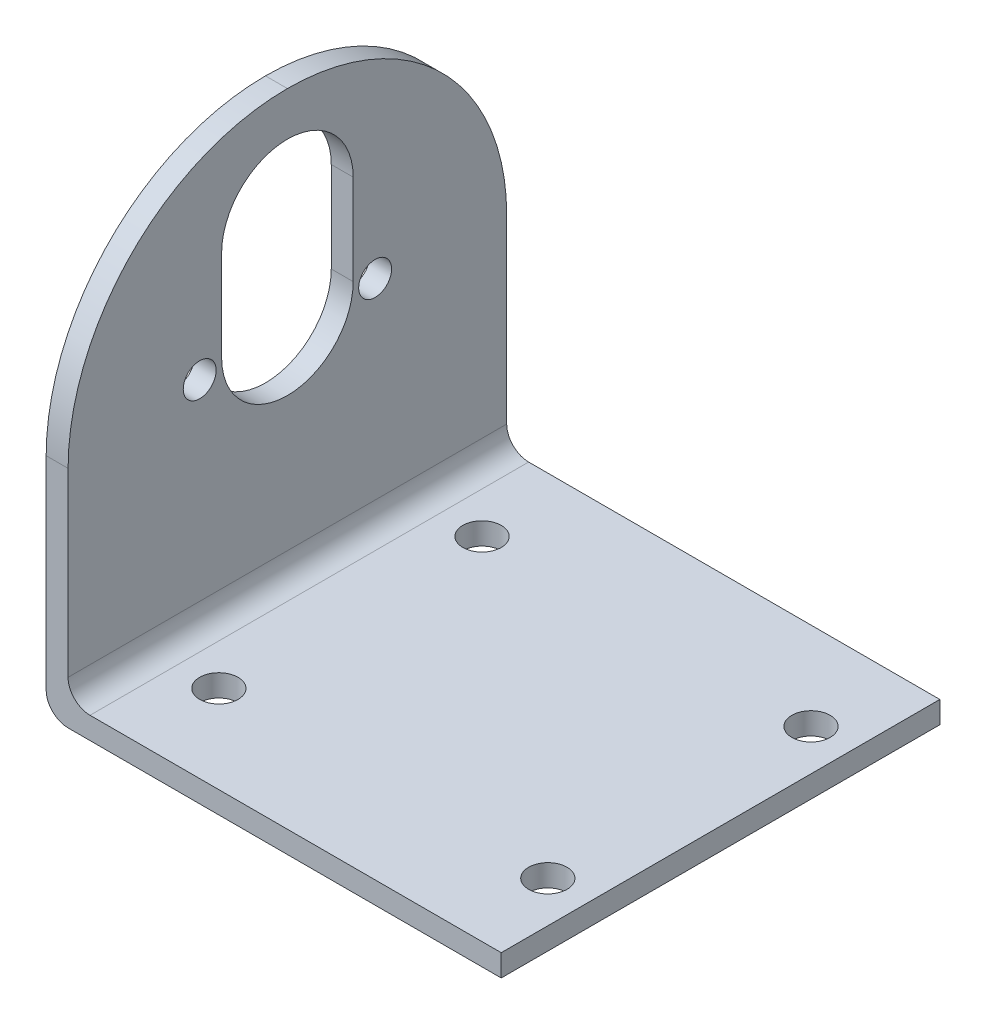
from build123d import *

# Parameters (mm, degrees)
EXTRUDE_1_DEPTH     = 40
SKETCH_2_R          = 1.75
CUT_EXTRUDE_1_DEPTH = 69.135893624
CUT_EXTRUDE_2_DEPTH = 69.135893624
FILLET_1_R          = 20
FILLET_2_R          = 20
SKETCH_7_R          = 1.5
CUT_EXTRUDE_3_DEPTH = 69.135893624


with BuildPart() as part:
    # 草图1 → 凸台-拉伸1 (new body)
    with BuildSketch(Plane.XY):
        with BuildLine():
            Line((0, 38.5), (0, 2))
            ThreePointArc((0, 2), (0.585786438, 0.585786438), (2, 0))
            Line((2, 0), (39.5, 0))
            Line((39.5, 0), (39.5, -2))
            Line((39.5, -2), (0, -2))
            ThreePointArc((0, -2), (-1.414213562, -1.414213562), (-2, 0))
            Line((-2, 0), (-2, 38.5))
            Line((-2, 38.5), (0, 38.5))
        make_face()
    extrude(amount=EXTRUDE_1_DEPTH)

    # 草图2 → 切除-拉伸1 (cut, through all)
    with BuildSketch(Plane(origin=(0, 0, 0), x_dir=(1, 0, 0), z_dir=(0, 1, 0))):
        with Locations(Location((5.75, -32, 0), (0, 0, 270))):
            Circle(SKETCH_2_R)
        with Locations(Location((35.75, -32, 0), (0, 0, 90))):
            Circle(SKETCH_2_R)
        with Locations(Location((5.75, -8, 0), (0, 0, 90))):
            Circle(SKETCH_2_R)
        with Locations(Location((35.75, -8, 0), (0, 0, 270))):
            Circle(SKETCH_2_R)
    extrude(amount=-CUT_EXTRUDE_1_DEPTH, mode=Mode.SUBTRACT)

    # 草图3 → 切除-拉伸2 (cut, through all)
    with BuildSketch(Plane(origin=(0, 0, 0), x_dir=(0, 0, -1), z_dir=(1, 0, 0))):
        with BuildLine():
            Line((-14, 28.5), (-14, 20.25))
            ThreePointArc((-14, 20.25), (-20, 14.25), (-26, 20.25))
            Line((-26, 20.25), (-26, 28.5))
            ThreePointArc((-26, 28.5), (-20, 34.5), (-14, 28.5))
        make_face()
    extrude(amount=-CUT_EXTRUDE_2_DEPTH, mode=Mode.SUBTRACT)

    # 圆角1
    fillet_1_edges = [part.edges().sort_by_distance(p)[0] for p in [
        (-1, 38.5, 40),
    ]]
    fillet(fillet_1_edges, radius=FILLET_1_R)

    # 圆角2
    fillet_2_edges = [part.edges().sort_by_distance(p)[0] for p in [
        (-1, 38.5, 0),
    ]]
    fillet(fillet_2_edges, radius=FILLET_2_R - 0.0001)  # a hair under: the kernel refuses the full size

    # 草图7 → 切除-拉伸3 (cut, through all)
    with BuildSketch(Plane(origin=(0, 0, 0), x_dir=(0, 0, -1), z_dir=(1, 0, 0))):
        with Locations(Location((-28, 19.5, 0), (0, 0, 90))):
            Circle(SKETCH_7_R)
        with Locations(Location((-12, 19.5, 0), (0, 0, 270))):
            Circle(SKETCH_7_R)
    extrude(amount=-CUT_EXTRUDE_3_DEPTH, mode=Mode.SUBTRACT)


solid = part.part
